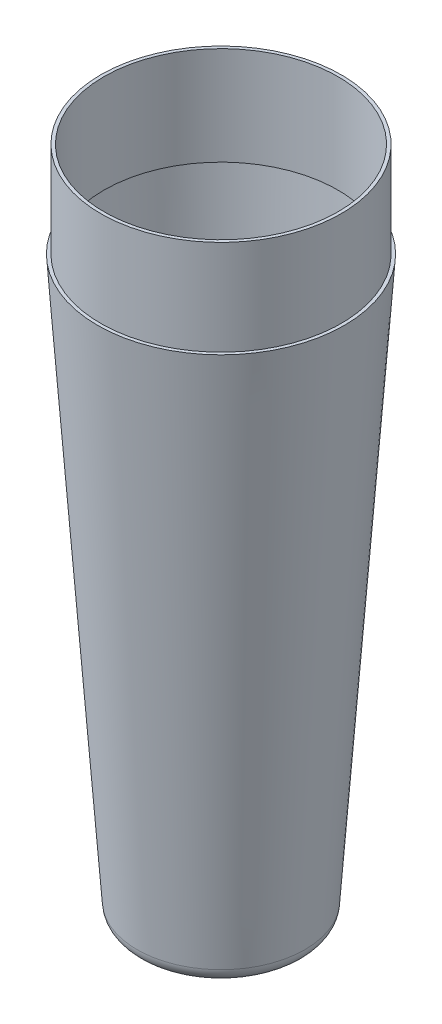
from build123d import *

# Parameters (mm, degrees)
BODY_START                   = 62.116699477
BODY_SHELL_OUTLINE_R         = 36.655940115
BODY_SHELL_DEPTH             = 30.774237315
BODY_SHELL_2_OUTLINE_R       = 37.655940115
BODY_SHELL_2_OUTLINE_R_2     = 36.655940115
BODY_SHELL_2_DEPTH           = 30.774237315
BASE_FILLET_R                = 5
PARTITION_EXTRUDE_DEPTH      = 2
PARTITION_EXTRUDE_DEPTH_BACK = 2
PARTITION_FILLET_1_R         = 2
PARTITION_FILLET_2_R         = 2


with BuildPart() as part:
    # Body Sketch → Body revolve (revolve)
    with BuildSketch(Plane.XY):
        Polygon((0, 0), (0, -112), (-25.3, -112), (-37.585940115, 62.116699477), (-36.655940115, 62.116699477), (-36.655940115, 92.890936792), (0, 92.890936792), align=None)
    revolve(axis=Axis((0, 0, 0), (0, -1, 0)))

    # Body Shell: read off the stored shape, not the designer's step
    # Body Shell outline → Body Shell (cut)
    with BuildSketch(Plane(origin=(0, 0, 0), x_dir=(1, 0, 0), z_dir=(0, 1, 0)).offset(BODY_START)):
        Circle(BODY_SHELL_OUTLINE_R)
    extrude(amount=BODY_SHELL_DEPTH, mode=Mode.SUBTRACT)

    # Body Shell 2 outline → Body Shell 2 (add)
    with BuildSketch(Plane(origin=(0, 0, 0), x_dir=(1, 0, 0), z_dir=(0, 1, 0)).offset(BODY_START)):
        Circle(BODY_SHELL_2_OUTLINE_R)
        Circle(BODY_SHELL_2_OUTLINE_R_2, mode=Mode.SUBTRACT)
    extrude(amount=BODY_SHELL_2_DEPTH)

    # Body Shell 3 outline → Body Shell 3 (revolve, cut)
    with BuildSketch(Plane.XY):
        Polygon((0, 62.116699477), (0, -117), (25.949678741, -117), (36.655940115, 34.729446569), (36.655940115, 62.116699477), align=None)
    revolve(axis=Axis((0, 0, 0), (0, 1, 0)), mode=Mode.SUBTRACT)

    # Body Shell 4 outline → Body Shell 4 (revolve)
    with BuildSketch(Plane.XY):
        Polygon((36.655940115, 62.116699477), (36.655940115, 34.729446569), (38.658988015, 63.116699477), (37.655940115, 63.116699477), (37.655940115, 62.116699477), align=None)
    revolve(axis=Axis((0, 0, 0), (0, 1, 0)))

    # Body Shell 5 outline → Body Shell 5 (revolve, cut)
    with BuildSketch(Plane.XY):
        Polygon((36.655940115, 62.116699477), (36.655940115, 48.936712516), (37.585940115, 62.116699477), align=None)
    revolve(axis=Axis((0, 0, 0), (0, 1, 0)), mode=Mode.SUBTRACT)

    # Body Shell 6 outline → Body Shell 6 (revolve)
    with BuildSketch(Plane.XY):
        Polygon((0, -112), (0, -117), (25.949678741, -117), (36.655940115, 34.729446569), (36.655940115, 48.936712516), (25.3, -112), align=None)
    revolve(axis=Axis((0, 0, 0), (0, 1, 0)))

    # Base Fillet
    base_fillet_edges = [part.edges().sort_by_distance(p)[0] for p in [
        (-25.949678741, -117, 0),
    ]]
    fillet(base_fillet_edges, radius=BASE_FILLET_R)

    # Partition Sketch → Partition Extrude (add, two sides: drawn at the far end of the back side and taken through both)
    with BuildSketch(Plane(origin=(0, 0, 0), x_dir=(0, 0, -1), z_dir=(1, 0, 0)).offset(-PARTITION_EXTRUDE_DEPTH_BACK)):
        Polygon((-25.32, -112.351932597), (25.32, -112.351932597), (26.77, -91.851932597), (-26.77, -91.851932597), align=None)
    extrude(amount=PARTITION_EXTRUDE_DEPTH + PARTITION_EXTRUDE_DEPTH_BACK)

    # Partition Fillet 1
    partition_fillet_1_edges = [part.edges().sort_by_distance(p)[0] for p in [
        (2, -91.851932597, 0),
    ]]
    fillet(partition_fillet_1_edges, radius=PARTITION_FILLET_1_R)

    # Partition Fillet 2
    partition_fillet_2_edges = [part.edges().sort_by_distance(p)[0] for p in [
        (-2, -91.851932597, 0),
    ]]
    fillet(partition_fillet_2_edges, radius=PARTITION_FILLET_2_R - 0.0001)  # a hair under: the kernel refuses the full size


solid = part.part
